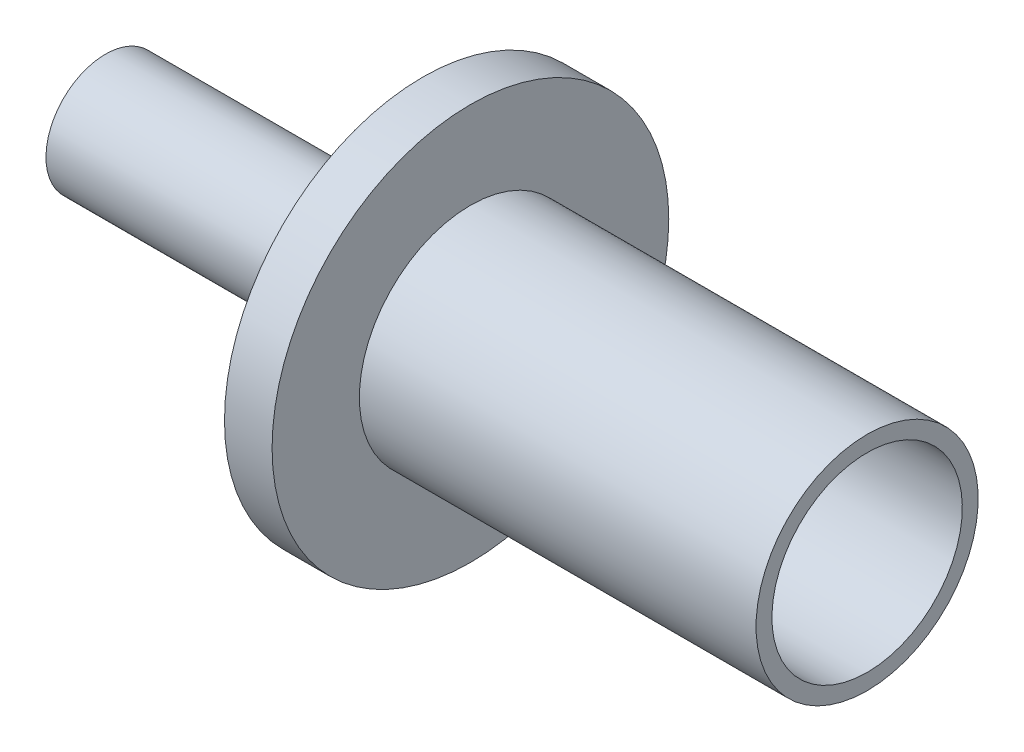
from build123d import *

# Parameters (mm, degrees)
CUT_EXTRUDE1_REACH = 68.227
SKETCH4_W          = 8
SKETCH4_H          = 13
CUT_EXTRUDE2_REACH = 68.227
SKETCH4_3_W        = 4.6
SKETCH4_3_H        = 13


with BuildPart() as part:
    # Sketch1 → Revolve1 (revolve)
    with BuildSketch(Plane.XY):
        Polygon((0, 25), (0, 7.5), (-40, 7.5), (-40, 6.5), (19, 6.5), (19, 12), (56, 12), (56, 14), (6, 14), (6, 25), align=None)
    revolve(axis=Axis((-64.900117457, 0, 0), (1, 0, 0)))

    # Sketch4 → Cut-Extrude1 (cut, up to next)
    with BuildSketch(Plane(origin=(0, 0, 0), x_dir=(1, 0, 0), z_dir=(0, 1, 0)), mode=Mode.PRIVATE) as cut_extrude1_sk1:
        with Locations((15, 0)):
            Rectangle(SKETCH4_W, SKETCH4_H)
    cut_extrude1_tool1 = extrude(cut_extrude1_sk1.sketch, amount=-CUT_EXTRUDE1_REACH, mode=Mode.PRIVATE) & part.part
    add(cut_extrude1_tool1.solids().sort_by_distance((15, 0, 0))[0], mode=Mode.SUBTRACT)

    # Sketch4<3> → Cut-Extrude2 (cut, up to next)
    with BuildSketch(Plane(origin=(0, 0, 0), x_dir=(1, 0, 0), z_dir=(0, 1, 0)), mode=Mode.PRIVATE) as cut_extrude2_sk1:
        with Locations((-7.3, 0)):
            Rectangle(SKETCH4_3_W, SKETCH4_3_H)
    cut_extrude2_tool1 = extrude(cut_extrude2_sk1.sketch, amount=CUT_EXTRUDE2_REACH, mode=Mode.PRIVATE) & part.part
    add(cut_extrude2_tool1.solids().sort_by_distance((-7.3, 0, 0))[0], mode=Mode.SUBTRACT)


solid = part.part
